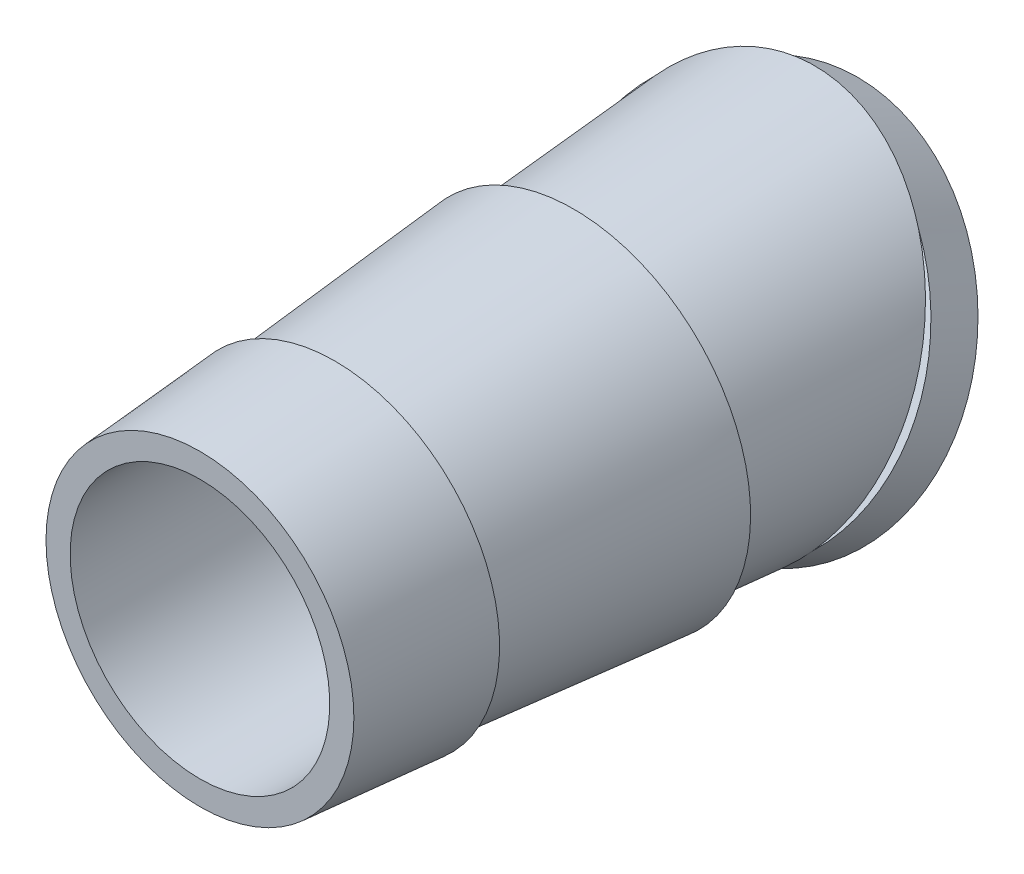
from build123d import *

# Parameters (mm, degrees)
SKETCH3_R           = 2.5
CUT_EXTRUDE1_DEPTH  = 16.142814305
CUT_EXTRUDE2_DEPTH  = 5
SKETCH5_R           = 3.5
SKETCH5_R_2         = 3
BOSS_EXTRUDE1_DEPTH = 1
CUT_EXTRUDE3_DEPTH  = 25


with BuildPart() as part:
    # Sketch2 → Revolve2 (revolve)
    with BuildSketch(Plane(origin=(0, 0, 0), x_dir=(0, 0, -1), z_dir=(1, 0, 0))):
        Polygon((-5.276966609, -1.587300884), (-0.677185359, -1.587300884), (8.565327607, -1.587300884), (8.565327607, 1.587300884), (8.565327607, 1.887300884), (3.922595891, 1.518766529), (3.922595891, 1.818766529), (-0.677185359, 1.401329029), (-0.677185359, 1.583891529), (-3.2832331, 1.377107492), (-5.276966609, 1.218909215), align=None)
    revolve(axis=Axis((0, -1.587300884, 0.677185359), (0, 0, -1)))

    # Sketch3 → Cut-Extrude1 (cut, through all)
    with BuildSketch(Plane(origin=(0, 0, -8.565327607), x_dir=(-1, 0, 0), z_dir=(0, 0, -1))):
        with Locations((0, -1.587300884)):
            Circle(SKETCH3_R)
    extrude(amount=-CUT_EXTRUDE1_DEPTH, mode=Mode.SUBTRACT)

    # Sketch4 → Cut-Extrude2 (cut, symmetric)
    with BuildSketch(Plane(origin=(0, 0, 0), x_dir=(0, 0, -1), z_dir=(1, 0, 0))):
        Polygon((5.356818875, -4.993368297), (8.565327607, 1.887300884), (8.565327607, -5.061902652), align=None)
    extrude(amount=CUT_EXTRUDE2_DEPTH, both=True, mode=Mode.SUBTRACT)

    # Sketch5 → Boss-Extrude1 (add)
    with BuildSketch(Plane(origin=(0, -2.943627179, -6.312628856), x_dir=(-1, 0, 0), z_dir=(0, -0.4226182617407003, -0.9063077870366495))):
        with Locations((0, 1.633383065)):
            Circle(SKETCH5_R)
        with Locations((0, 1.633383065)):
            Circle(SKETCH5_R_2, mode=Mode.SUBTRACT)
    extrude(amount=BOSS_EXTRUDE1_DEPTH)

    # Sketch6 → Cut-Extrude3 (cut, symmetric)
    with BuildSketch(Plane(origin=(0, 0, 0), x_dir=(0, 0, -1), z_dir=(1, 0, 0))):
        Polygon((-5.276966609, 1.218909215), (-5.276966609, 2.912508145), (-3.276966609, 2.912508145), (-3.276966609, -5.12655092), (-5.276966609, -5.12655092), align=None)
    extrude(amount=CUT_EXTRUDE3_DEPTH, both=True, mode=Mode.SUBTRACT)


solid = part.part
